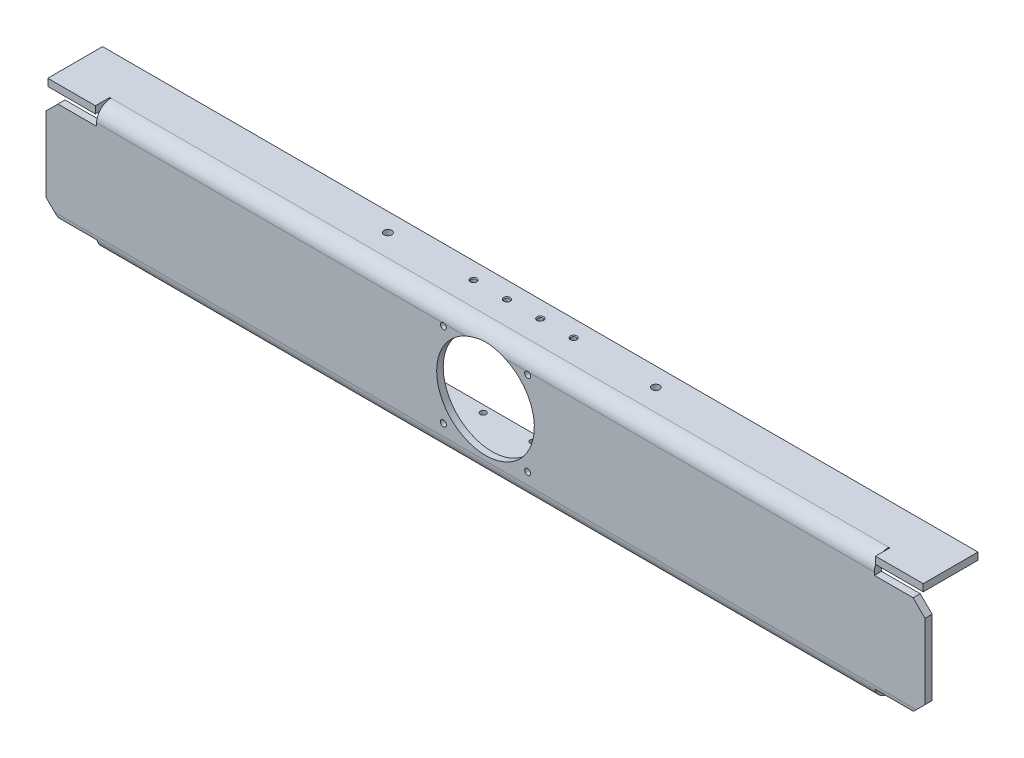
from build123d import *

# Parameters (mm, degrees)
SM_BASE_FLANGE_1_DEPTH = 367.5
CUT_EXTRUDE_1337_DEPTH = 40.5
CUT_EXTRUDE_2_DEPTH    = 41
CUT_EXTRUDE_START      = -41
CUT_EXTRUDE_3_DEPTH    = 41
SKETCH_6_W             = 40
SKETCH_6_H             = 6
EXTRUDE_4_DEPTH        = 12
EXTRUDE_START          = 42.5
EXTRUDE_5_DEPTH        = 42.5
EXTRUDE_6_DEPTH        = 42.5
CHAMFER_1_SIZE         = 10
M6X1_01_D              = 5
M6X1_01_CSINK_D        = 6.5
M6X1_01_CSINK_ANGLE    = 90
SKETCH_10_R            = 41
CUT_EXTRUDE_7_DEPTH    = 376.015749694
M5X0_81_D              = 4.2
M5X0_81_DEPTH          = 4.5
M5X0_81_CSINK_D        = 5.5
M5X0_81_CSINK_ANGLE    = 90
M6X1_02_D              = 5
M6X1_02_DEPTH          = 6
M6X1_02_CSINK_D        = 6.5
M6X1_02_CSINK_ANGLE    = 90
CUT_EXTRUDE_8_REACH    = 386.75
SKETCH_17_R            = 3.25


# Sheet-metal steps are written as plain solids
with BuildPart() as part:
    # Sketch 1 → Базовая кромка1 (new, symmetric)
    with BuildSketch(Plane(origin=(0, 0, 0), x_dir=(0, 0, -1), z_dir=(1, 0, 0))):
        with BuildLine():
            Line((23, 53.25), (-11, 53.25))
            ThreePointArc((-11, 53.25), (-19.485281374, 49.735281374), (-23, 41.25))
            Line((-23, 41.25), (-23, -41.25))
            ThreePointArc((-23, -41.25), (-19.485281374, -49.735281374), (-11, -53.25))
            Line((-11, -53.25), (23, -53.25))
            Line((23, -53.25), (23, -47.25))
            Line((23, -47.25), (-11, -47.25))
            ThreePointArc((-11, -47.25), (-15.242640687, -45.492640687), (-17, -41.25))
            Line((-17, -41.25), (-17, 41.25))
            ThreePointArc((-17, 41.25), (-15.242640687, 45.492640687), (-11, 47.25))
            Line((-11, 47.25), (23, 47.25))
            Line((23, 47.25), (23, 53.25))
        make_face()
    extrude(amount=SM_BASE_FLANGE_1_DEPTH, both=True)

    # Эскиз3 → Cut-Extrude 1337 (cut)
    with BuildSketch(Plane(origin=(0, 0, -23), x_dir=(-1, 0, 0), z_dir=(0, 0, -1))):
        with BuildLine():
            Line((-45, -41.25), (45, -41.25))
            ThreePointArc((45, -41.25), (47.121320344, -40.371320344), (48, -38.25))
            Line((48, -38.25), (48, 45.75))
            ThreePointArc((48, 45.75), (47.121320344, 47.871320344), (45, 48.75))
            Line((45, 48.75), (-45, 48.75))
            ThreePointArc((-45, 48.75), (-47.121320344, 47.871320344), (-48, 45.75))
            Line((-48, 45.75), (-48, -38.25))
            ThreePointArc((-48, -38.25), (-47.121320344, -40.371320344), (-45, -41.25))
        make_face()
    extrude(amount=-CUT_EXTRUDE_1337_DEPTH, mode=Mode.SUBTRACT)

    # Эскиз4 → Вытянуть2 (cut)
    with BuildSketch(Plane(origin=(367.5, 0, 0), x_dir=(0, 0, -1), z_dir=(1, 0, 0))):
        with BuildLine():
            Line((-11, 47.25), (-11, 53.25))
            ThreePointArc((-11, 53.25), (-19.485281374, 49.735281374), (-23, 41.25))
            Line((-23, 41.25), (-23, -41.25))
            ThreePointArc((-23, -41.25), (-19.485281374, -49.735281374), (-11, -53.25))
            Line((-11, -53.25), (23, -53.25))
            Line((23, -53.25), (23, -47.25))
            Line((23, -47.25), (-11, -47.25))
            ThreePointArc((-11, -47.25), (-15.242640687, -45.492640687), (-17, -41.25))
            Line((-17, -41.25), (-17, 41.25))
            ThreePointArc((-17, 41.25), (-15.242640687, 45.492640687), (-11, 47.25))
        make_face()
    extrude(amount=-CUT_EXTRUDE_2_DEPTH, mode=Mode.SUBTRACT)

    # Эскиз5 → Вытянуть3 (cut)
    with BuildSketch(Plane.ZY.offset(367.5).offset(CUT_EXTRUDE_START)):
        with BuildLine():
            Line((11, 53.25), (11, 47.25))
            ThreePointArc((11, 47.25), (15.242640687, 45.492640687), (17, 41.25))
            Line((17, 41.25), (17, -41.25))
            ThreePointArc((17, -41.25), (15.242640687, -45.492640687), (11, -47.25))
            Line((11, -47.25), (-23, -47.25))
            Line((-23, -47.25), (-23, -53.25))
            Line((-23, -53.25), (11, -53.25))
            ThreePointArc((11, -53.25), (19.485281374, -49.735281374), (23, -41.25))
            Line((23, -41.25), (23, 41.25))
            ThreePointArc((23, 41.25), (19.485281374, 49.735281374), (11, 53.25))
        make_face()
    extrude(amount=CUT_EXTRUDE_3_DEPTH, mode=Mode.SUBTRACT)

    # Эскиз6 → Вытянуть4 (add)
    with BuildSketch(Plane.XY.offset(11)):
        with Locations((-347.5, 50.25)):
            Rectangle(SKETCH_6_W, SKETCH_6_H)
        with Locations((347.5, 50.25)):
            Rectangle(SKETCH_6_W, SKETCH_6_H)
    extrude(amount=EXTRUDE_4_DEPTH)

    # Эскиз8 → Вытянуть5 (add)
    with BuildSketch(Plane(origin=(326.5, 0, 0), x_dir=(0, 0, -1), z_dir=(1, 0, 0)).offset(EXTRUDE_START)):
        with BuildLine():
            Line((-17, -41.25), (-17, 38.75))
            Line((-17, 38.75), (-23, 38.75))
            Line((-23, 38.75), (-23, -41.25))
            ThreePointArc((-23, -41.25), (-22.916902714, -42.659762285), (-22.668761717, -44.05))
            Line((-22.668761717, -44.05), (-16.306599665, -44.05))
            ThreePointArc((-16.306599665, -44.05), (-16.824070655, -42.692290195), (-17, -41.25))
        make_face()
    extrude(amount=-EXTRUDE_5_DEPTH)

    # Эскиз9 → Вытянуть6 (add)
    with BuildSketch(Plane.ZY.offset(326.5)):
        with BuildLine():
            Line((17, 38.75), (17, -41.25))
            ThreePointArc((17, -41.25), (16.824070655, -42.692290195), (16.306599665, -44.05))
            Line((16.306599665, -44.05), (22.668761717, -44.05))
            ThreePointArc((22.668761717, -44.05), (22.916902714, -42.659762285), (23, -41.25))
            Line((23, -41.25), (23, 38.75))
            Line((23, 38.75), (17, 38.75))
        make_face()
    extrude(amount=EXTRUDE_6_DEPTH)

    # Фаска1
    chamfer_1_edges = [part.edges().sort_by_distance(p)[0] for p in [
        (-369, 38.75, 20),
        (-369, -44.05, 19.487680691),
        (369, 38.75, 20),
        (369, -44.05, 19.487680691),
    ]]
    chamfer(chamfer_1_edges, length=CHAMFER_1_SIZE)

    # Отверстие обработанное метчиком M6x1.01 (through all)
    with Locations(Plane(origin=(0, 0, 17.5), x_dir=(-1, 0, 0), z_dir=(0, 0, -1))):
        with Locations((-35.355339059, 39.105339059), (35.355339059, 39.105339059), (35.355339059, -31.605339059), (-35.355339059, -31.605339059)):
            CounterSinkHole(M6X1_01_D / 2, M6X1_01_CSINK_D / 2, counter_sink_angle=M6X1_01_CSINK_ANGLE)

    # Эскиз10 → Вытянуть7 (cut, through all)
    with BuildSketch(Plane(origin=(0, 0, 17.5), x_dir=(-1, 0, 0), z_dir=(0, 0, -1))):
        with Locations((0, 3.75)):
            Circle(SKETCH_10_R)
    extrude(amount=-CUT_EXTRUDE_7_DEPTH, mode=Mode.SUBTRACT)

    # Отверстие обработанное метчиком M5x0.81
    with Locations(Plane(origin=(0, 53.25, 0), x_dir=(-1, 0, 0), z_dir=(0, 1, 0))):
        with Locations((42, -9), (-42, -9), (-14, -9), (14, -9)):
            CounterSinkHole(M5X0_81_D / 2, M5X0_81_CSINK_D / 2, depth=M5X0_81_DEPTH, counter_sink_angle=M5X0_81_CSINK_ANGLE)

    # Отверстие обработанное метчиком M6x1.02
    with Locations(Plane.XZ.offset(53.25)):
        with Locations((0, -17), (-42, -17), (42, -17)):
            CounterSinkHole(M6X1_02_D / 2, M6X1_02_CSINK_D / 2, depth=M6X1_02_DEPTH, counter_sink_angle=M6X1_02_CSINK_ANGLE)

    # Эскиз17 → Вытянуть8 (cut, up to next)
    with BuildSketch(Plane(origin=(0, 53.25, 0), x_dir=(1, 0, 0), z_dir=(0, 1, 0)), mode=Mode.PRIVATE) as cut_extrude_8_sk1:
        with Locations(Location((-112.5, 7.5, 0), (0, 0, 270))):
            Circle(SKETCH_17_R)
    cut_extrude_8_tool1 = extrude(cut_extrude_8_sk1.sketch, amount=-CUT_EXTRUDE_8_REACH, mode=Mode.PRIVATE) & part.part
    # Эскиз17 → Вытянуть8 (cut, up to next)
    with BuildSketch(Plane(origin=(0, 53.25, 0), x_dir=(1, 0, 0), z_dir=(0, 1, 0)), mode=Mode.PRIVATE) as cut_extrude_8_sk2:
        with Locations(Location((112.5, 7.5, 0), (0, 0, 270))):
            Circle(SKETCH_17_R)
    cut_extrude_8_tool2 = extrude(cut_extrude_8_sk2.sketch, amount=-CUT_EXTRUDE_8_REACH, mode=Mode.PRIVATE) & part.part
    add(cut_extrude_8_tool1.solids().sort_by_distance((-112.5, 53.25, -7.5))[0], mode=Mode.SUBTRACT)
    add(cut_extrude_8_tool2.solids().sort_by_distance((112.5, 53.25, -7.5))[0], mode=Mode.SUBTRACT)


solid = part.part
